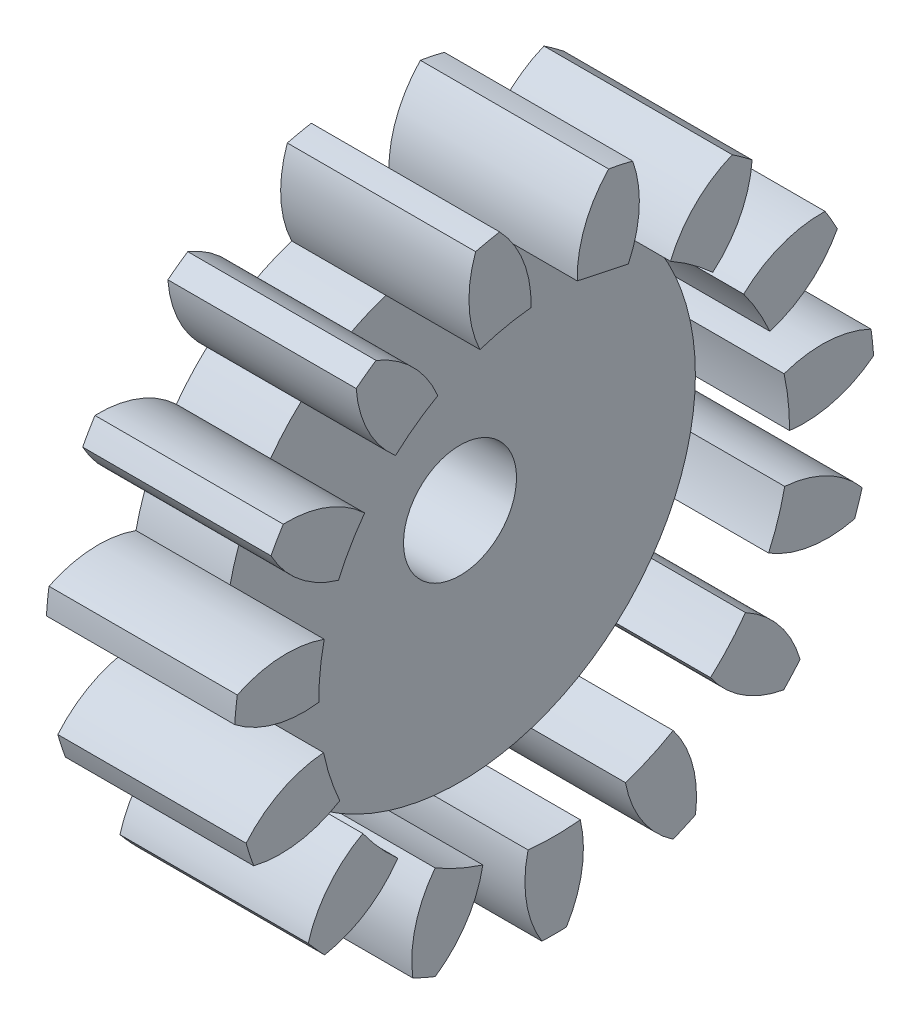
from build123d import *

# Parameters (mm, degrees)
BASPROSKE_W         = 5
BASPROSKE_H         = 17
TOOTHCUT_DEPTH      = 25.556058316
TEETHCUTS_COUNT     = 15
TEETHCUTS_ANGLE     = 336
BORSKE_R            = 3
BORE_DEPTH          = 50.0000508
BOSS_EXTRUDE1_START = 5
BOSS_EXTRUDE1_DEPTH = 5


with BuildPart() as part:
    # BasProSke → Base-Revolve (revolve)
    with BuildSketch(Plane(origin=(0, 0, 0), x_dir=(1, 0, 0), z_dir=(0, 1, 0))):
        with Locations((2.5, 8.5)):
            Rectangle(BASPROSKE_W, BASPROSKE_H)
    revolve(axis=Axis((-10, 0, 0), (1, 0, 0)))

    # TooCutSke → ToothCut (cut, through all)
    with BuildSketch(Plane(origin=(0, 0, 0), x_dir=(0, 0, -1), z_dir=(1, 0, 0))):
        with BuildLine():
            ThreePointArc((1.225947666, 12.438731982), (0, 12.499), (-1.225947666, 12.438731982))
            ThreePointArc((-1.225947666, 12.438731982), (-1.633372372, 14.776760457), (-2.915451202, 16.773919919))
            ThreePointArc((-2.915451202, 16.773919919), (0, 17.0254), (2.915451202, 16.773919919))
            ThreePointArc((2.915451202, 16.773919919), (1.633372372, 14.776760457), (1.225947666, 12.438731982))
        make_face()
    toothcut = extrude(amount=TOOTHCUT_DEPTH, mode=Mode.SUBTRACT)

    # TeethCuts: ToothCut ×15 about axis
    teethcuts_axis = Axis((-10, 0, 0), (1, 0, 0))
    for i in range(1, TEETHCUTS_COUNT):
        add(toothcut.rotate(teethcuts_axis, i * TEETHCUTS_ANGLE / (TEETHCUTS_COUNT - 1)), mode=Mode.SUBTRACT)

    # BorSke → Bore (cut, symmetric)
    with BuildSketch(Plane(origin=(0, 0, 0), x_dir=(0, 0, -1), z_dir=(1, 0, 0))):
        Circle(BORSKE_R)
    extrude(amount=BORE_DEPTH, both=True, mode=Mode.SUBTRACT)

    # Sketch1 → Boss-Extrude1 (add)
    with BuildSketch(Plane(origin=(5, 0, 0), x_dir=(0, 0, -1), z_dir=(1, 0, 0)).offset(BOSS_EXTRUDE1_START)):
        with BuildLine():
            Line((1.225947666, 12.438731982), (3.939329169, 11.861984939))
            ThreePointArc((3.939329169, 11.861984939), (4.517345534, 14.148270791), (4.169644461, 16.480717978))
            ThreePointArc((4.169644461, 16.480717978), (3.534498744, 16.628509212), (2.894152149, 16.751832238))
            ThreePointArc((2.894152149, 16.751832238), (1.627819674, 14.762458473), (1.225947666, 12.438731982))
        make_face()
        with BuildLine():
            ThreePointArc((-3.939763316, 11.862894462), (-2.598896135, 12.226845009), (-1.225920989, 12.439739456))
            ThreePointArc((-1.225920989, 12.439739456), (-1.628001472, 14.76292845), (-2.894152149, 16.751832238))
            ThreePointArc((-2.894152149, 16.751832238), (-3.534498744, 16.628509212), (-4.169644461, 16.480717978))
            ThreePointArc((-4.169644461, 16.480717978), (-4.51737061, 14.14877408), (-3.939763316, 11.862894462))
        make_face()
        with BuildLine():
            ThreePointArc((9.457523559, 14.126402519), (7.491877309, 12.824438373), (6.179632418, 10.865640486))
            ThreePointArc((6.179632418, 10.865640486), (7.347315654, 10.11271243), (8.424226752, 9.234847245))
            ThreePointArc((8.424226752, 9.234847245), (9.881648274, 11.088168135), (10.512471663, 13.359937857))
            ThreePointArc((10.512471663, 13.359937857), (9.992349289, 13.753288904), (9.457523559, 14.126402519))
        make_face()
        with BuildLine():
            ThreePointArc((-8.424226752, 9.234847245), (-7.347315654, 10.11271243), (-6.179632418, 10.865640486))
            ThreePointArc((-6.179632418, 10.865640486), (-7.491877309, 12.824438373), (-9.457523559, 14.126402519))
            ThreePointArc((-9.457523559, 14.126402519), (-9.992349289, 13.753288904), (-10.512471663, 13.359937857))
            ThreePointArc((-10.512471663, 13.359937857), (-9.881648274, 11.088168135), (-8.424226752, 9.234847245))
        make_face()
        with BuildLine():
            ThreePointArc((14.385603227, 9.05838947), (12.060339498, 8.668486395), (10.064829262, 7.412773565))
            ThreePointArc((10.064829262, 7.412773565), (10.825317547, 6.25), (11.452064851, 5.010011043))
            ThreePointArc((11.452064851, 5.010011043), (13.53729918, 6.110317186), (15.037597012, 7.929103109))
            ThreePointArc((15.037597012, 7.929103109), (14.722431864, 8.5), (14.385603227, 9.05838947))
        make_face()
        with BuildLine():
            ThreePointArc((-11.452064851, 5.010011043), (-10.825317547, 6.25), (-10.064829262, 7.412773565))
            ThreePointArc((-10.064829262, 7.412773565), (-12.060339498, 8.668486395), (-14.385603227, 9.05838947))
            ThreePointArc((-14.385603227, 9.05838947), (-14.722431864, 8.5), (-15.037597012, 7.929103109))
            ThreePointArc((-15.037597012, 7.929103109), (-13.53729918, 6.110317186), (-11.452064851, 5.010011043))
        make_face()
        with BuildLine():
            ThreePointArc((16.826281408, 2.424098589), (14.543459423, 3.013674369), (12.20972569, 2.678170752))
            ThreePointArc((12.20972569, 2.678170752), (12.431523692, 1.306605791), (12.499736899, -0.081101583))
            ThreePointArc((12.499736899, -0.081101583), (14.852228075, 0.075936885), (16.962585225, 1.127254399))
            ThreePointArc((16.962585225, 1.127254399), (16.906872221, 1.776983876), (16.826281408, 2.424098589))
        make_face()
        with BuildLine():
            ThreePointArc((-12.499736899, -0.081101583), (-12.431523692, 1.306605791), (-12.20972569, 2.678170752))
            ThreePointArc((-12.20972569, 2.678170752), (-14.543459423, 3.013674369), (-16.826281408, 2.424098589))
            ThreePointArc((-16.826281408, 2.424098589), (-16.906872221, 1.776983876), (-16.962585225, 1.127254399))
            ThreePointArc((-16.962585225, 1.127254399), (-14.852228075, 0.075936885), (-12.499736899, -0.081101583))
        make_face()
        with BuildLine():
            ThreePointArc((16.357542672, -4.629340961), (14.511883091, -3.162229334), (12.243449624, -2.519512115))
            ThreePointArc((12.243449624, -2.519512115), (11.888206454, -3.86271243), (11.38609088, -5.158191008))
            ThreePointArc((11.38609088, -5.158191008), (13.599071808, -5.971573593), (15.954588353, -5.869506836))
            ThreePointArc((15.954588353, -5.869506836), (16.167960777, -5.253288904), (16.357542672, -4.629340961))
        make_face()
        with BuildLine():
            ThreePointArc((-11.38609088, -5.158191008), (-11.888206454, -3.86271243), (-12.243449624, -2.519512115))
            ThreePointArc((-12.243449624, -2.519512115), (-14.511883091, -3.162229334), (-16.357542672, -4.629340961))
            ThreePointArc((-16.357542672, -4.629340961), (-16.167960777, -5.253288904), (-15.954588353, -5.869506836))
            ThreePointArc((-15.954588353, -5.869506836), (-13.599071808, -5.971573593), (-11.38609088, -5.158191008))
        make_face()
        with BuildLine():
            ThreePointArc((13.060436204, -10.882325402), (11.971070336, -8.791354857), (10.160169891, -7.281548448))
            ThreePointArc((10.160169891, -7.281548448), (9.289310318, -8.364132579), (8.303686309, -9.343382347))
            ThreePointArc((8.303686309, -9.343382347), (9.994512481, -10.986544747), (12.187898211, -11.851377017))
            ThreePointArc((12.187898211, -11.851377017), (12.633462033, -11.375220308), (13.060436204, -10.882325402))
        make_face()
        with BuildLine():
            ThreePointArc((-8.303686309, -9.343382347), (-9.289310318, -8.364132579), (-10.160169891, -7.281548448))
            ThreePointArc((-10.160169891, -7.281548448), (-11.971070336, -8.791354857), (-13.060436204, -10.882325402))
            ThreePointArc((-13.060436204, -10.882325402), (-12.633462033, -11.375220308), (-12.187898211, -11.851377017))
            ThreePointArc((-12.187898211, -11.851377017), (-9.994512481, -10.986544747), (-8.303686309, -9.343382347))
        make_face()
        with BuildLine():
            ThreePointArc((7.505061666, -15.253656919), (7.360350766, -12.900375259), (6.32010448, -10.784538903))
            ThreePointArc((6.32010448, -10.784538903), (5.084208038, -11.419318221), (3.785498938, -11.913017997))
            ThreePointArc((3.785498938, -11.913017997), (4.661811149, -14.101842504), (6.313809745, -15.784036445))
            ThreePointArc((6.313809745, -15.784036445), (6.914522932, -15.53027278), (7.505061666, -15.253656919))
        make_face()
        with BuildLine():
            ThreePointArc((-3.785498938, -11.913017997), (-5.084208038, -11.419318221), (-6.32010448, -10.784538903))
            ThreePointArc((-6.32010448, -10.784538903), (-7.360350766, -12.900375259), (-7.505061666, -15.253656919))
            ThreePointArc((-7.505061666, -15.253656919), (-6.914522932, -15.53027278), (-6.313809745, -15.784036445))
            ThreePointArc((-6.313809745, -15.784036445), (-4.661811149, -14.101842504), (-3.785498938, -11.913017997))
        make_face()
        with BuildLine():
            ThreePointArc((0.651993785, -16.987492579), (1.476959682, -14.778803582), (1.387235589, -12.422784608))
            ThreePointArc((1.387235589, -12.422784608), (0, -12.5), (-1.387235589, -12.422784608))
            ThreePointArc((-1.387235589, -12.422784608), (-1.476959682, -14.778803582), (-0.651993785, -16.987492579))
            ThreePointArc((-0.651993785, -16.987492579), (0, -17), (0.651993785, -16.987492579))
        make_face()
    extrude(amount=-BOSS_EXTRUDE1_DEPTH)


solid = part.part
